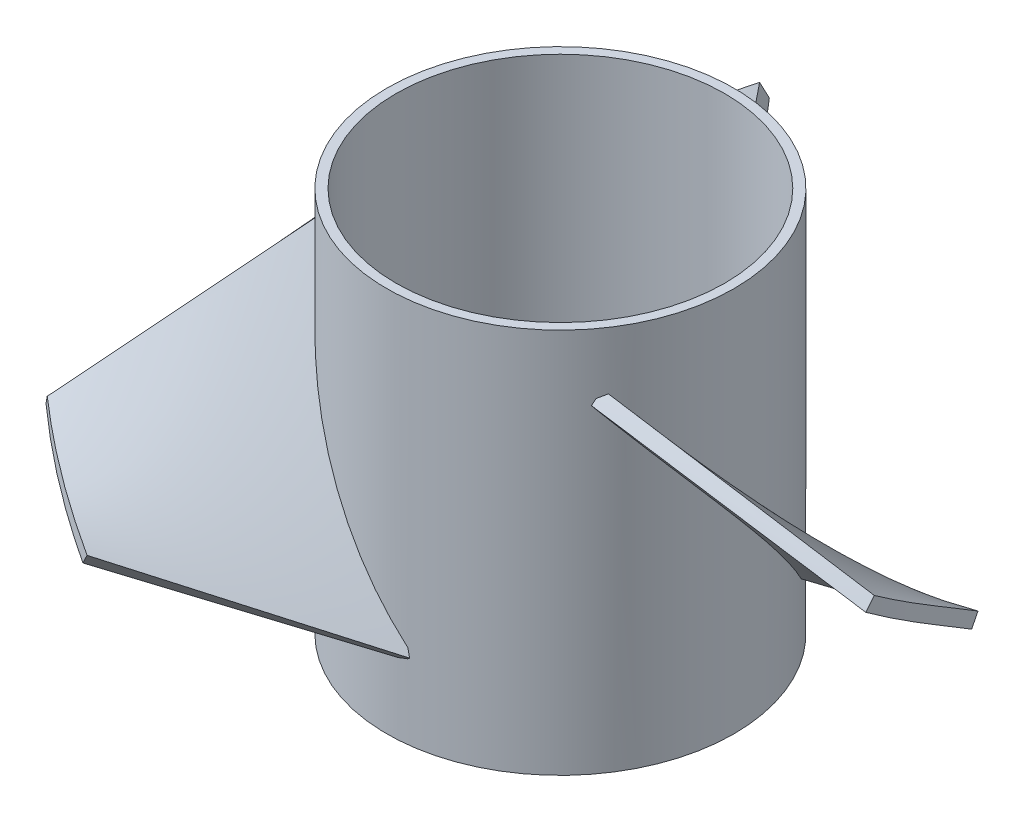
from build123d import *

# Parameters (mm, degrees)
CUT_EXTRUDE1_START           = -20
SKETCH6_R                    = 14.5
CUT_EXTRUDE1_DEPTH           = 40.0001
EXTRUDE_THIN3_DEPTH          = 16
EXTRUDE_THIN3_DEPTH_BACK     = 12
SKETCH5_R                    = 14.95
SKETCH5_R_2                  = 14.15
CIRPATTERN5_COUNT            = 3
EXTRUDE_THIN4_DEPTH          = 16
EXTRUDE_THIN4_DEPTH_BACK     = 16
SKETCH7_R                    = 14.95
SKETCH7_R_2                  = 14.15
BOSS_EXTRUDE1_START          = 1.2
SKETCH8_R                    = 14.95
BOSS_EXTRUDE1_DEPTH          = 1.2
CUT_EXTRUDE2_DEPTH           = 1.2
CUT_EXTRUDE2_DEPTH_BACK      = 1.2
SKETCH9_R                    = 1.5
CUT_EXTRUDE3_DEPTH           = 1.2
CUT_EXTRUDE3_DEPTH_BACK      = 11.2
SKETCH10_R                   = 5
CUT_EXTRUDE_THIN1_DEPTH      = 38
CUT_EXTRUDE_THIN1_DEPTH_BACK = 10
SKETCH11_R                   = 41.5
SKETCH11_R_2                 = 31.5


with BuildPart() as part:
    # Sketch3 → Loft2 section 0
    with BuildSketch(Plane(origin=(12, 0, 0), x_dir=(0, 0, -1), z_dir=(1, 0, 0))):
        with BuildLine():
            Line((-9.323237579, 10.4612256), (-8.394019199, 11.220536604))
            Line((-8.394019199, 11.220536604), (9.323237579, -10.4612256))
            Line((9.323237579, -10.4612256), (8.394019199, -11.220536604))
            Line((8.394019199, -11.220536604), (-9.323237579, 10.4612256))
        make_face()
    # Sketch4 → Loft2 section 1
    with BuildSketch(Plane(origin=(32, 0, 0), x_dir=(0, 0, -1), z_dir=(1, 0, 0))):
        with BuildLine():
            Line((-4.623440432, 1.995945532), (-4.019948701, 3.033152228))
            Line((-4.019948701, 3.033152228), (4.623440432, -1.995945532))
            Line((4.623440432, -1.995945532), (4.019948701, -3.033152228))
            Line((4.019948701, -3.033152228), (-4.623440432, 1.995945532))
        make_face()
    loft2 = loft()

    # Sketch6 → Cut-Extrude1 (cut)
    with BuildSketch(Plane(origin=(0, 0, 0), x_dir=(1, 0, 0), z_dir=(0, 1, 0)).offset(CUT_EXTRUDE1_START)):
        Circle(SKETCH6_R)
    cut_extrude1 = extrude(amount=CUT_EXTRUDE1_DEPTH, mode=Mode.SUBTRACT)

    # Sketch5 → Extrude-Thin3 (add, two sides: drawn at the far end of the back side and taken through both)
    with BuildSketch(Plane(origin=(0, 0, 0), x_dir=(1, 0, 0), z_dir=(0, 1, 0)).offset(-EXTRUDE_THIN3_DEPTH_BACK)):
        Circle(SKETCH5_R)
        Circle(SKETCH5_R_2, mode=Mode.SUBTRACT)
    extrude(amount=EXTRUDE_THIN3_DEPTH + EXTRUDE_THIN3_DEPTH_BACK)

    # CirPattern5: Loft2, Cut-Extrude1 ×3 about axis
    cirpattern5_axis = Axis((0, 16, 0), (0, 1, 0))
    add([loft2.rotate(cirpattern5_axis, i * 360 / CIRPATTERN5_COUNT) for i in range(1, CIRPATTERN5_COUNT)])
    add([cut_extrude1.rotate(cirpattern5_axis, i * 360 / CIRPATTERN5_COUNT) for i in range(1, CIRPATTERN5_COUNT)], mode=Mode.SUBTRACT)

    # Sketch7 → Extrude-Thin4 (add, two sides: drawn at the far end of the back side and taken through both)
    with BuildSketch(Plane(origin=(0, 0, 0), x_dir=(1, 0, 0), z_dir=(0, 1, 0)).offset(-EXTRUDE_THIN4_DEPTH_BACK)):
        Circle(SKETCH7_R)
        Circle(SKETCH7_R_2, mode=Mode.SUBTRACT)
    extrude(amount=EXTRUDE_THIN4_DEPTH + EXTRUDE_THIN4_DEPTH_BACK)

    # Sketch8 → Boss-Extrude1 (add)
    with BuildSketch(Plane.XZ.offset(16).offset(BOSS_EXTRUDE1_START)):
        Circle(SKETCH8_R)
    extrude(amount=-BOSS_EXTRUDE1_DEPTH)

    # Sketch9 → Cut-Extrude2 (cut, two sides: drawn at the far end of the back side and taken through both)
    with BuildSketch(Plane.XZ.offset(17.2).offset(-CUT_EXTRUDE2_DEPTH_BACK)):
        with Locations((4.944101958, 7.520362746)):
            Circle(SKETCH9_R)
        with Locations((-4.944101958, -7.520362746)):
            Circle(SKETCH9_R)
    extrude(amount=CUT_EXTRUDE2_DEPTH + CUT_EXTRUDE2_DEPTH_BACK, mode=Mode.SUBTRACT)

    # Sketch10 → Cut-Extrude3 (cut, two sides: drawn at the far end of the back side and taken through both)
    with BuildSketch(Plane.XZ.offset(17.2).offset(-CUT_EXTRUDE3_DEPTH_BACK)):
        Circle(SKETCH10_R)
    extrude(amount=CUT_EXTRUDE3_DEPTH + CUT_EXTRUDE3_DEPTH_BACK, mode=Mode.SUBTRACT)

    # Sketch11 → Cut-Extrude-Thin1 (cut, two sides: drawn at the far end of the back side and taken through both)
    with BuildSketch(Plane(origin=(0, -17.2, 0), x_dir=(1, 0, 0), z_dir=(0, 1, 0)).offset(-CUT_EXTRUDE_THIN1_DEPTH_BACK)):
        Circle(SKETCH11_R)
        Circle(SKETCH11_R_2, mode=Mode.SUBTRACT)
    extrude(amount=CUT_EXTRUDE_THIN1_DEPTH + CUT_EXTRUDE_THIN1_DEPTH_BACK, mode=Mode.SUBTRACT)


solid = part.part
